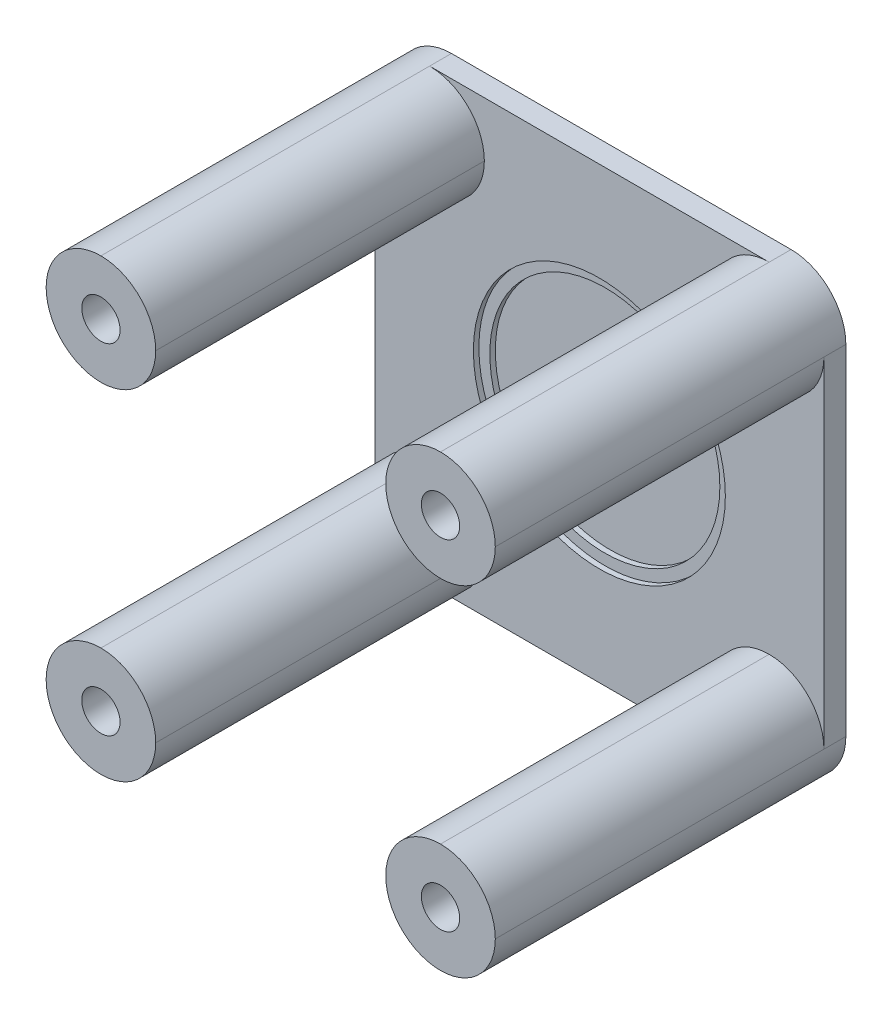
from build123d import *

# Parameters (mm, degrees)
SKETCH1_W           = 41
SKETCH1_H           = 41
SKETCH1_R           = 1.75
SKETCH1_R_2         = 1.25
BOSS_EXTRUDE1_DEPTH = 2
SKETCH2_W           = 10
SKETCH2_H           = 10
SKETCH2_R           = 1.75
BOSS_EXTRUDE2_DEPTH = 30
FILLET1_R           = 5
SKETCH3_R           = 10.5
CUT_EXTRUDE1_DEPTH  = 1
SKETCH4_R           = 11.5
CUT_EXTRUDE2_DEPTH  = 0.5


with BuildPart() as part:
    # Sketch1 → Boss-Extrude1 (new body)
    with BuildSketch(Plane.XY):
        with Locations((-34.508333333, 4.35625)):
            Rectangle(SKETCH1_W, SKETCH1_H)
        with Locations((-50.008333333, 19.85625)):
            Circle(SKETCH1_R, mode=Mode.SUBTRACT)
        with Locations((-50.008333333, -11.14375)):
            Circle(SKETCH1_R, mode=Mode.SUBTRACT)
        with Locations((-19.008333333, -11.14375)):
            Circle(SKETCH1_R, mode=Mode.SUBTRACT)
        with Locations((-19.008333333, 19.85625)):
            Circle(SKETCH1_R, mode=Mode.SUBTRACT)
        with Locations((-34.508333333, 4.35625)):
            Circle(SKETCH1_R_2, mode=Mode.SUBTRACT)
    extrude(amount=BOSS_EXTRUDE1_DEPTH)

    # Sketch2 → Boss-Extrude2 (add)
    # profile 1 of 4: a face of its own
    with BuildSketch(Plane.XY.offset(2)):
        with Locations((-50.008333333, 19.85625)):
            Rectangle(SKETCH2_W, SKETCH2_H)
        with Locations((-50.008333333, 19.85625)):
            Circle(SKETCH2_R, mode=Mode.SUBTRACT)
    # profile 2 of 4: a face of its own
    with BuildSketch(Plane.XY.offset(2)):
        with Locations((-50.008333333, -11.14375)):
            Rectangle(SKETCH2_W, SKETCH2_H)
        with Locations((-50.008333333, -11.14375)):
            Circle(SKETCH2_R, mode=Mode.SUBTRACT)
    # profile 3 of 4: a face of its own
    with BuildSketch(Plane.XY.offset(2)):
        with Locations((-19.008333333, -11.14375)):
            Rectangle(SKETCH2_W, SKETCH2_H)
        with Locations((-19.008333333, -11.14375)):
            Circle(SKETCH2_R, mode=Mode.SUBTRACT)
    # profile 4 of 4: a face of its own
    with BuildSketch(Plane.XY.offset(2)):
        with Locations((-19.008333333, 19.85625)):
            Rectangle(SKETCH2_W, SKETCH2_H)
        with Locations((-19.008333333, 19.85625)):
            Circle(SKETCH2_R, mode=Mode.SUBTRACT)
    extrude(amount=BOSS_EXTRUDE2_DEPTH)

    # Fillet1
    fillet1_edges = [part.edges().sort_by_distance(p)[0] for p in [
        (-24.008333333, 24.85625, 17),
        (-24.008333333, -6.14375, 17),
        (-55.008333333, -6.14375, 17),
        (-55.008333333, 14.85625, 17),
        (-45.008333333, 24.85625, 17),
        (-45.008333333, -6.14375, 17),
        (-45.008333333, -16.14375, 17),
        (-24.008333333, -16.14375, 17),
        (-14.008333333, -6.14375, 17),
        (-14.008333333, 14.85625, 17),
        (-24.008333333, 14.85625, 17),
        (-45.008333333, 14.85625, 17),
        (-14.008333333, -16.14375, 16),
        (-14.008333333, 24.85625, 16),
        (-55.008333333, -16.14375, 16),
        (-55.008333333, 24.85625, 16),
    ]]
    fillet(fillet1_edges, radius=FILLET1_R - 0.0001)  # a hair under: the kernel refuses the full size

    # Sketch3 → Cut-Extrude1 (cut)
    with BuildSketch(Plane.XY.offset(2)):
        with Locations((-34.508333333, 4.35625)):
            Circle(SKETCH3_R)
    extrude(amount=-CUT_EXTRUDE1_DEPTH, mode=Mode.SUBTRACT)

    # Sketch4 → Cut-Extrude2 (cut)
    with BuildSketch(Plane.XY.offset(2)):
        with Locations((-34.508333333, 4.35625)):
            Circle(SKETCH4_R)
    extrude(amount=-CUT_EXTRUDE2_DEPTH, mode=Mode.SUBTRACT)


solid = part.part
